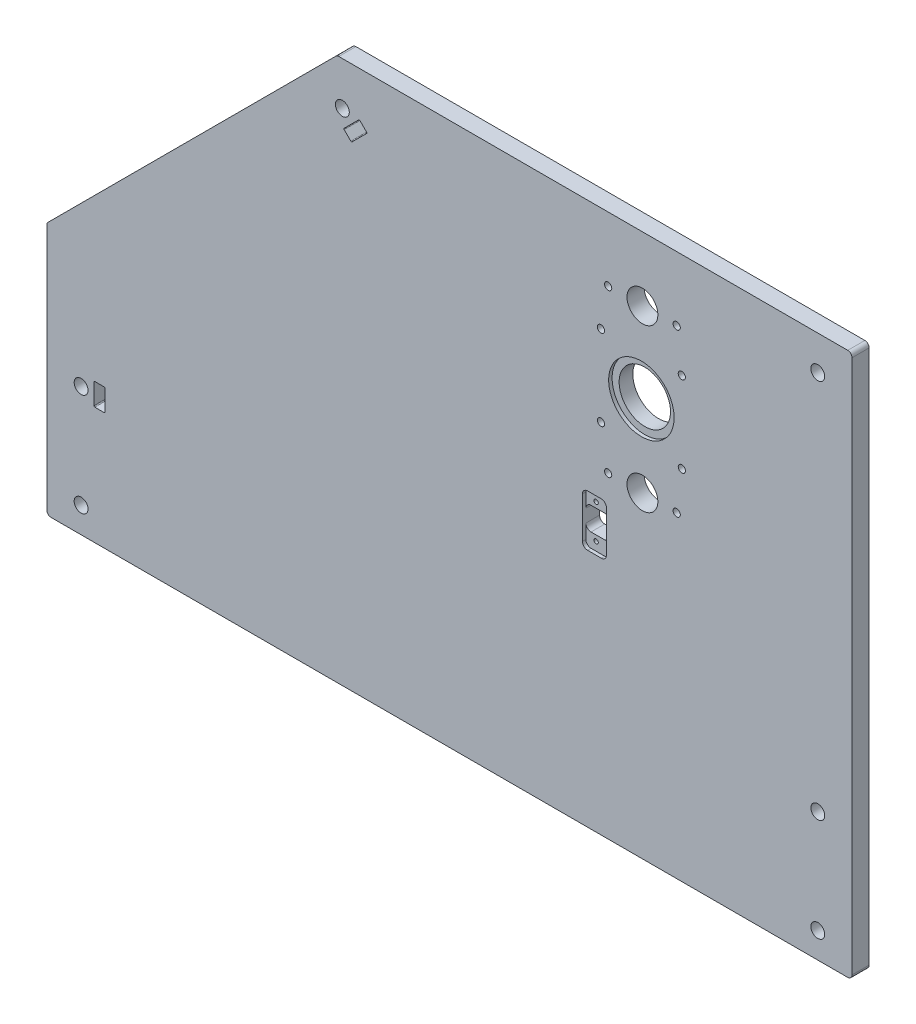
from build123d import *

# Parameters (mm, degrees)
SKETCH2_W             = 470
SKETCH2_H             = 317
BOSS_EXTRUDE1_DEPTH   = 5
SKETCH3_R             = 4.05
CUT_EXTRUDE1_DEPTH    = 10
SKETCH4_R             = 9
CUT_EXTRUDE2_DEPTH    = 284.632244288
M5X0_8_TAPPED_HOLE1_D = 4.2
SKETCH7_R             = 19.1
CUT_EXTRUDE5_DEPTH    = 2
M5X0_8_TAPPED_HOLE2_D = 4.2
SKETCH19_R            = 15
CUT_EXTRUDE10_DEPTH   = 284.568774727
SKETCH20_W            = 14
SKETCH20_H            = 30
CUT_EXTRUDE11_DEPTH   = 2
M3X0_5_TAPPED_HOLE2_D = 2.5
SKETCH23_W            = 14
SKETCH23_H            = 13.5
CUT_EXTRUDE13_DEPTH   = 284.568774727
CUT_EXTRUDE14_DEPTH   = 284.632244288
FILLET1_R             = 3
FILLET2_R             = 2.5
SKETCH27_R            = 4.05
CUT_EXTRUDE15_DEPTH   = 284.632244288
CUT_EXTRUDE16_DEPTH   = 284.632244288
CUT_EXTRUDE17_DEPTH   = 284.632244288


with BuildPart() as part:
    # Sketch2 → Boss-Extrude1 (new, symmetric)
    with BuildSketch(Plane.XY):
        Rectangle(SKETCH2_W, SKETCH2_H)
    extrude(amount=BOSS_EXTRUDE1_DEPTH, both=True)

    # Sketch3 → Cut-Extrude1 (cut)
    with BuildSketch(Plane.XY.offset(5)):
        with Locations((-215, -83.5)):
            Circle(SKETCH3_R)
        with Locations((-215, -143.5)):
            Circle(SKETCH3_R)
        with Locations((215, -143.5)):
            Circle(SKETCH3_R)
        with Locations((-62.5, 133.34)):
            Circle(SKETCH3_R)
        with Locations((215, 138.5)):
            Circle(SKETCH3_R)
    extrude(amount=-CUT_EXTRUDE1_DEPTH, mode=Mode.SUBTRACT)

    # Sketch4 → Cut-Extrude2 (cut, through all)
    with BuildSketch(Plane.XY.offset(5)):
        with Locations((112.65, 121)):
            Circle(SKETCH4_R)
        with Locations((112.65, 26.5)):
            Circle(SKETCH4_R)
    extrude(amount=-CUT_EXTRUDE2_DEPTH, mode=Mode.SUBTRACT)

    # M5x0.8 Tapped Hole1 (through all)
    with Locations(Plane.XY.offset(5)):
        with Locations((132.65, 121), (92.65, 121), (92.65, 26.5), (132.65, 26.5)):
            Hole(M5X0_8_TAPPED_HOLE1_D / 2)

    # Sketch7 → Cut-Extrude5 (cut)
    with BuildSketch(Plane.XY.offset(5)):
        with Locations((112.05, 73.75)):
            Circle(SKETCH7_R)
    extrude(amount=-CUT_EXTRUDE5_DEPTH, mode=Mode.SUBTRACT)

    # M5x0.8 Tapped Hole2 (through all)
    with Locations(Plane.XY.offset(5)):
        with Locations((88.45, 97.35), (135.65, 97.35), (135.65, 50.15), (88.45, 50.15)):
            Hole(M5X0_8_TAPPED_HOLE2_D / 2)

    # Sketch19 → Cut-Extrude10 (cut, through all)
    with BuildSketch(Plane.XY.offset(3)):
        with Locations((112.05, 73.75)):
            Circle(SKETCH19_R)
    extrude(amount=-CUT_EXTRUDE10_DEPTH, mode=Mode.SUBTRACT)

    # Sketch20 → Cut-Extrude11 (cut)
    with BuildSketch(Plane.XY.offset(5)):
        with Locations((84.65, -3.5)):
            Rectangle(SKETCH20_W, SKETCH20_H)
    extrude(amount=-CUT_EXTRUDE11_DEPTH, mode=Mode.SUBTRACT)

    # M3x0.5 Tapped Hole2 (through all)
    with Locations(Plane.XY.offset(3)):
        with Locations((83.65, 6.5), (83.65, -13.5)):
            Hole(M3X0_5_TAPPED_HOLE2_D / 2)

    # Sketch23 → Cut-Extrude13 (cut, through all)
    with BuildSketch(Plane.XY.offset(3)):
        with Locations((84.65, -3.5)):
            Rectangle(SKETCH23_W, SKETCH23_H)
    extrude(amount=-CUT_EXTRUDE13_DEPTH, mode=Mode.SUBTRACT)

    # Sketch26 → Cut-Extrude14 (cut, through all)
    with BuildSketch(Plane.XY.offset(5)):
        Polygon((-32.351626406, 191.772644842), (-286.046542749, -61.922271502), (-286.046542749, 282.491923936), align=None)
    extrude(amount=-CUT_EXTRUDE14_DEPTH, mode=Mode.SUBTRACT)

    # Fillet1
    fillet1_edges = [part.edges().sort_by_distance(p)[0] for p in [
        (91.65, -18.5, 4),
        (77.65, -18.5, 4),
        (77.65, 11.5, 4),
        (91.65, 11.5, 4),
        (77.65, -10.25, -1),
        (77.65, 3.25, -1),
        (91.65, 3.25, -1),
        (91.65, -10.25, -1),
    ]]
    fillet(fillet1_edges, radius=FILLET1_R)

    # Fillet2
    fillet2_edges = [part.edges().sort_by_distance(p)[0] for p in [
        (-235, -158.5, 0),
        (235, -158.5, 0),
        (235, 158.5, 0),
        (-235, -10.875728753, 0),
        (-65.624271247, 158.5, 0),
    ]]
    fillet(fillet2_edges, radius=FILLET2_R)

    # Sketch27 → Cut-Extrude15 (cut, through all)
    with BuildSketch(Plane.XY.offset(5)):
        with Locations((215, -83.5)):
            Circle(SKETCH27_R)
    extrude(amount=-CUT_EXTRUDE15_DEPTH, mode=Mode.SUBTRACT)

    # Sketch28 → Cut-Extrude16 (cut, through all)
    with BuildSketch(Plane.XY.offset(5)):
        with BuildLine():
            Line((-61.439339828, 123.086951673), (-57.550252532, 119.197864376))
            ThreePointArc((-57.550252532, 119.197864376), (-57.196699141, 119.051417767), (-56.843145751, 119.197864376))
            Line((-56.843145751, 119.197864376), (-48.357864376, 127.683145751))
            ThreePointArc((-48.357864376, 127.683145751), (-48.211417767, 128.036699141), (-48.357864376, 128.390252532))
            Line((-48.357864376, 128.390252532), (-52.246951673, 132.279339828))
            ThreePointArc((-52.246951673, 132.279339828), (-52.600505063, 132.425786438), (-52.954058454, 132.279339828))
            Line((-52.954058454, 132.279339828), (-61.439339828, 123.794058454))
            ThreePointArc((-61.439339828, 123.794058454), (-61.585786438, 123.440505063), (-61.439339828, 123.086951673))
        make_face()
    extrude(amount=-CUT_EXTRUDE16_DEPTH, mode=Mode.SUBTRACT)

    # Sketch29 → Cut-Extrude17 (cut, through all)
    with BuildSketch(Plane.XY.offset(5)):
        with BuildLine():
            Line((-207, -90), (-201.5, -90))
            ThreePointArc((-201.5, -90), (-201.146446609, -89.853553391), (-201, -89.5))
            Line((-201, -89.5), (-201, -77.5))
            ThreePointArc((-201, -77.5), (-201.146446609, -77.146446609), (-201.5, -77))
            Line((-201.5, -77), (-207, -77))
            ThreePointArc((-207, -77), (-207.353553391, -77.146446609), (-207.5, -77.5))
            Line((-207.5, -77.5), (-207.5, -89.5))
            ThreePointArc((-207.5, -89.5), (-207.353553391, -89.853553391), (-207, -90))
        make_face()
    extrude(amount=-CUT_EXTRUDE17_DEPTH, mode=Mode.SUBTRACT)


solid = part.part
